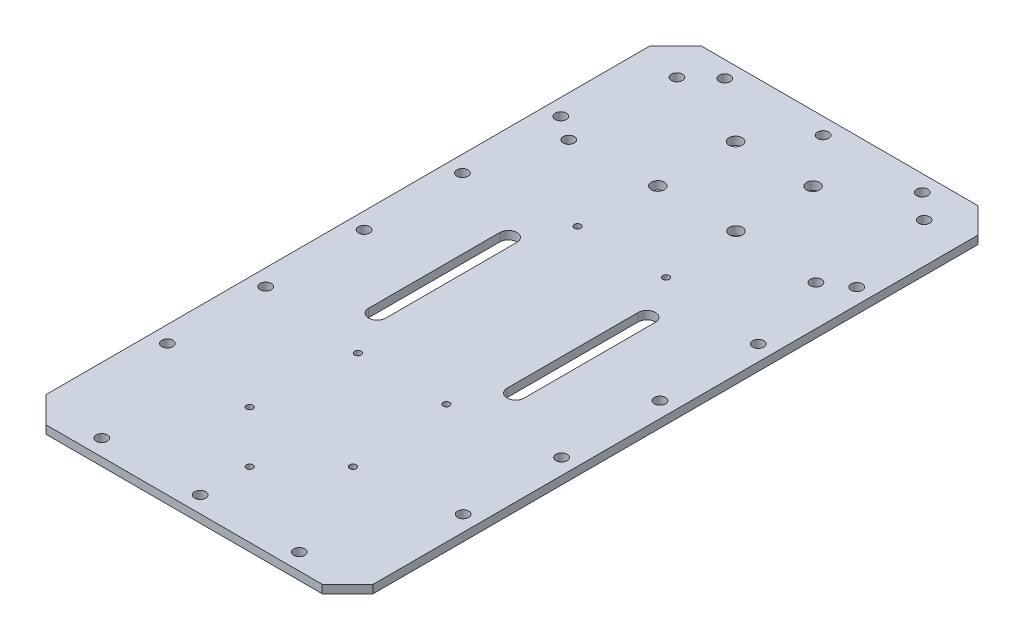
from build123d import *

# Parameters (mm, degrees)
SKETCH2_R           = 2.159
SKETCH2_R_2         = 1.27
SKETCH2_R_3         = 2.54
BOSS_EXTRUDE1_DEPTH = 3.175


with BuildPart() as part:
    # Sketch2 → Boss-Extrude1 (new body)
    with BuildSketch(Plane(origin=(0, 0, 0), x_dir=(1, 0, 0), z_dir=(0, 1, 0))):
        Polygon((0, 243.857064852), (0, 10.142935148), (10.142935148, 0), (117.142935148, 0), (127, 9.857064852), (127, 244.142935148), (117.142935148, 254), (10.142935148, 254), align=None)
        with Locations((25.4, 6.35)):
            Circle(SKETCH2_R, mode=Mode.SUBTRACT)
        with Locations((6.35, 50.8)):
            Circle(SKETCH2_R, mode=Mode.SUBTRACT)
        with Locations((43.642935148, 45.4)):
            Circle(SKETCH2_R_2, mode=Mode.SUBTRACT)
        with Locations((6.35, 88.9)):
            Circle(SKETCH2_R, mode=Mode.SUBTRACT)
        with Locations((46.497935148, 84.455)):
            Circle(SKETCH2_R_2, mode=Mode.SUBTRACT)
        with Locations((63.5, 6.35)):
            Circle(SKETCH2_R, mode=Mode.SUBTRACT)
        with Locations((63.642935148, 25.4)):
            Circle(SKETCH2_R_2, mode=Mode.SUBTRACT)
        with Locations((83.642935148, 45.4)):
            Circle(SKETCH2_R_2, mode=Mode.SUBTRACT)
        with Locations((101.885870296, 6.35)):
            Circle(SKETCH2_R, mode=Mode.SUBTRACT)
        with Locations((120.935870296, 50.8)):
            Circle(SKETCH2_R, mode=Mode.SUBTRACT)
        with Locations((80.787935148, 84.455)):
            Circle(SKETCH2_R_2, mode=Mode.SUBTRACT)
        with Locations((120.935870296, 88.9)):
            Circle(SKETCH2_R, mode=Mode.SUBTRACT)
        with Locations((6.35, 127)):
            Circle(SKETCH2_R, mode=Mode.SUBTRACT)
        with Locations((6.35, 165.1)):
            Circle(SKETCH2_R, mode=Mode.SUBTRACT)
        with BuildLine():
            Line((33.51128717, 101.6), (33.51128717, 152.4))
            ThreePointArc((33.51128717, 152.4), (36.827111159, 155.715823989), (40.142935148, 152.4))
            Line((40.142935148, 152.4), (40.142935148, 101.6))
            ThreePointArc((40.142935148, 101.6), (36.827111159, 98.284176011), (33.51128717, 101.6))
        make_face(mode=Mode.SUBTRACT)
        with Locations((46.497935148, 169.545)):
            Circle(SKETCH2_R_2, mode=Mode.SUBTRACT)
        with Locations((6.35, 203.2)):
            Circle(SKETCH2_R, mode=Mode.SUBTRACT)
        with Locations((15.763935148, 196.85)):
            Circle(SKETCH2_R, mode=Mode.SUBTRACT)
        with Locations((15.763935148, 238.76)):
            Circle(SKETCH2_R, mode=Mode.SUBTRACT)
        with Locations((25.4, 247.65)):
            Circle(SKETCH2_R, mode=Mode.SUBTRACT)
        with Locations((48.50003, 198.60006)):
            Circle(SKETCH2_R_3, mode=Mode.SUBTRACT)
        with Locations((48.642965148, 228.59965949)):
            Circle(SKETCH2_R_3, mode=Mode.SUBTRACT)
        with Locations((63.5, 247.65)):
            Circle(SKETCH2_R, mode=Mode.SUBTRACT)
        with BuildLine():
            ThreePointArc((87.142935148, 152.4), (90.458759136, 155.715823989), (93.774583125, 152.4))
            Line((93.774583125, 152.4), (93.774583125, 101.6))
            ThreePointArc((93.774583125, 101.6), (90.458759136, 98.284176011), (87.142935148, 101.6))
            Line((87.142935148, 101.6), (87.142935148, 152.4))
        make_face(mode=Mode.SUBTRACT)
        with Locations((80.787935148, 169.545)):
            Circle(SKETCH2_R_2, mode=Mode.SUBTRACT)
        with Locations((120.935870296, 127)):
            Circle(SKETCH2_R, mode=Mode.SUBTRACT)
        with Locations((120.935870296, 165.1)):
            Circle(SKETCH2_R, mode=Mode.SUBTRACT)
        with Locations((78.785840296, 198.60006)):
            Circle(SKETCH2_R_3, mode=Mode.SUBTRACT)
        with Locations((78.642905148, 228.59965949)):
            Circle(SKETCH2_R_3, mode=Mode.SUBTRACT)
        with Locations((111.521935148, 196.85)):
            Circle(SKETCH2_R, mode=Mode.SUBTRACT)
        with Locations((120.935870296, 203.2)):
            Circle(SKETCH2_R, mode=Mode.SUBTRACT)
        with Locations((101.885870296, 247.65)):
            Circle(SKETCH2_R, mode=Mode.SUBTRACT)
        with Locations((111.521935148, 238.76)):
            Circle(SKETCH2_R, mode=Mode.SUBTRACT)
    extrude(amount=BOSS_EXTRUDE1_DEPTH)


solid = part.part
